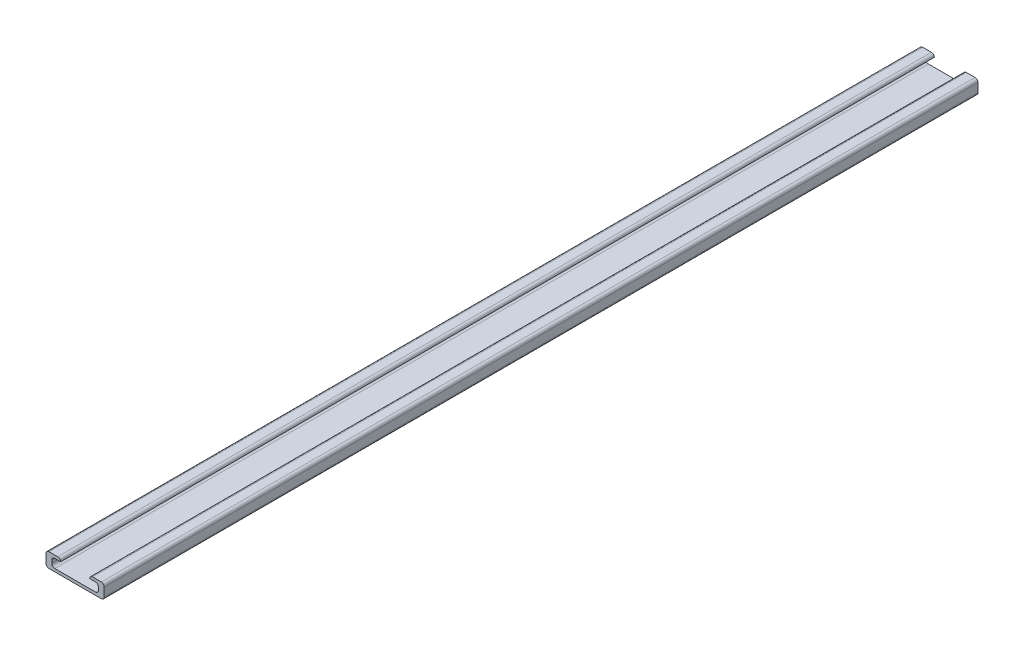
from build123d import *

# Parameters (mm, degrees)
BOSS_EXTRUDE1_DEPTH = 300
FILLET2_R           = 1


with BuildPart() as part:
    # Sketch1 → Boss-Extrude1 (new body)
    with BuildSketch(Plane.XY):
        Polygon((0, 0), (-20, 0), (-20, 5), (-15, 5), (-15, 4), (-18, 4), (-18, 1), (-2, 1), (-2, 4), (-5, 4), (-5, 5), (0, 5), align=None)
    extrude(amount=BOSS_EXTRUDE1_DEPTH)

    # Fillet2
    fillet2_edges = [part.edges().sort_by_distance(p)[0] for p in [
        (-18, 4, 150),
        (-2, 4, 150),
        (-2, 1, 150),
        (-18, 1, 150),
        (-20, 0, 150),
        (-20, 5, 150),
        (-15, 5, 150),
        (0, 0, 150),
        (0, 5, 150),
        (-5, 5, 150),
    ]]
    fillet(fillet2_edges, radius=FILLET2_R - 0.0001)  # a hair under: the kernel refuses the full size


solid = part.part
